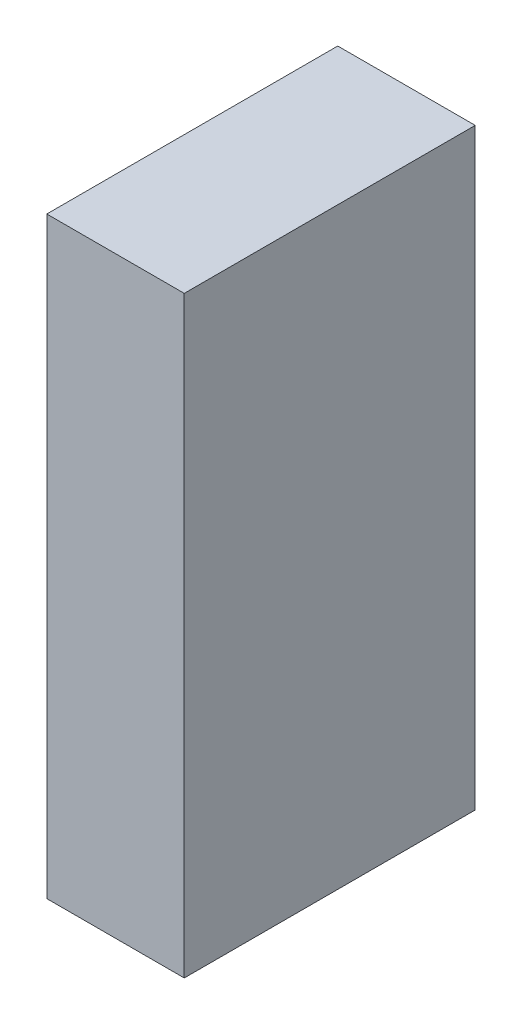
from build123d import *

# Parameters (mm, degrees)
SKETCH1_W                                    = 184.15
SKETCH1_H                                    = 184.15
PANEL_DEPTH                                  = 2.75
LED_HOLE_REACH                               = 132.243
SKETCH19_R                                   = 2.75
LED_HOLES_PATTERN_COUNT                      = 13
LED_HOLES_PATTERN_PITCH                      = 12.319
LED_HOLES_PATTERN_COUNT_DIR2                 = 10
LED_HOLES_PATTERN_PITCH_DIR2                 = 15.94
SKETCH2_R                                    = 2.75
SKETCH2_W                                    = 4.99243385
SKETCH2_H                                    = 2.307727076
CORNER_LEDS_LIGHT_SENSOR_CUT_DEPTH           = 131.242749318
LIGHT_SENSOR_HOLDER_DEPTH                    = 2.4
SKETCH6_W                                    = 164.47360298
SKETCH6_H                                    = 161.542860252
OUTER_LIGHT_WALLS_DEPTH                      = 6.35
SKETCH7_W                                    = 158.47360298
SKETCH7_H                                    = 155.542860252
OUTER_LIGHT_WALLS_CUT_DEPTH                  = 7.5
SKETCH8_W                                    = 158.47560298
SKETCH8_H                                    = 3
INNER_H_WALLS_DEPTH                          = 7.5
INNER_H_WALLS_PATTERN_COUNT                  = 9
INNER_H_WALLS_PATTERN_PITCH                  = 15.94
INNER_START                                  = -1.15
INNER_V_WALLS_1ST_LINE_DEPTH                 = 7.5
INNER_V_WALLS_PATTERN_1ST_LINE_COUNT         = 12
INNER_V_WALLS_PATTERN_1ST_LINE_PITCH         = 12.32
SKETCH13_W                                   = 3
SKETCH13_H                                   = 12.501430126
EXTRA_V_WALLS_REMOVAL_1ST_LINE_DEPTH         = 7.5
SKETCH14_W                                   = 3
SKETCH14_H                                   = 12.94
INNER_V_WALLS_DEPTH                          = 6.35
INNER_V_WALLS_PATTERN_COUNT                  = 12
INNER_V_WALLS_PATTERN_PITCH                  = 12.32
INNER_V_WALLS_PATTERN_COUNT_DIR2             = 9
INNER_V_WALLS_PATTERN_PITCH_DIR2             = 15.94
SKETCH15_W                                   = 3
SKETCH15_H                                   = 12.94
EXTRA_V_WALLS_REMOVAL_DEPTH                  = 7.5
SKETCH16_W                                   = 6.43819851
SKETCH16_H                                   = 3
SKETCH16_W_2                                 = 3
SKETCH16_H_2                                 = 7.903569874
CORNER_LED_LIGHT_BAFFLES_DEPTH               = 6.35
CORNER_LED_LIGHT_BAFFLES_MIRROR_2_COPY_1_W   = 6.43819851
CORNER_LED_LIGHT_BAFFLES_MIRROR_2_COPY_1_H   = 3
CORNER_LED_LIGHT_BAFFLES_MIRROR_2_COPY_1_W_2 = 3
CORNER_LED_LIGHT_BAFFLES_MIRROR_2_COPY_1_H_2 = 7.903569874
CORNER_LED_LIGHT_BAFFLES_MIRROR_2_CO_2_DEPTH = 6.35
LED_STRIP_SQUARE_HOLE_1ST_LINE_REACH         = 132.43
SKETCH20_W                                   = 5.5
SKETCH20_H                                   = 5.5
LED_STRIP_SQUARE_HOLE_REACH                  = 132.43
SKETCH22_W                                   = 5.5
SKETCH22_H                                   = 5.5
LED_STRIP_SQUARE_HOLES_PATTERN_COUNT         = 13
LED_STRIP_SQUARE_HOLES_PATTERN_PITCH         = 12.319
LED_STRIP_SQUARE_HOLES_PATTERN_COUNT_DIR2    = 6
LED_STRIP_SQUARE_HOLES_PATTERN_PITCH_DIR2    = 15.94
SKETCH27_W                                   = 149.47360298
SKETCH27_H                                   = 7.903569874
SKETCH27_W_2                                 = 6.43819851
SKETCH27_H_2                                 = 146.542860252
CUT_EXTRUDE15_DEPTH                          = 1
CHAMFER1_SIZE                                = 1
SKETCH30_OUTSIDE_W                           = 238.268
SKETCH30_OUTSIDE_H                           = 238.268
SKETCH30_OUTSIDE_W_2                         = 3
SKETCH30_OUTSIDE_H_2                         = 12.94
CUT_EXTRUDE24_DEPTH                          = 7.5


with BuildPart() as part:
    # Sketch1 → panel (new body)
    with BuildSketch(Plane.XY):
        Rectangle(SKETCH1_W, SKETCH1_H)
    extrude(amount=PANEL_DEPTH)

    # Sketch19 → LED hole (cut, up to next)
    with BuildSketch(Plane.XY.offset(2.75), mode=Mode.PRIVATE) as led_hole_sk1:
        with Locations((-73.915, 71.74)):
            Circle(SKETCH19_R)
    led_hole_tool1 = extrude(led_hole_sk1.sketch, amount=-LED_HOLE_REACH, mode=Mode.PRIVATE) & part.part
    led_hole = led_hole_tool1.solids().sort_by_distance((-73.915, 71.74, 2.75))[0]
    add(led_hole, mode=Mode.SUBTRACT)

    # LED holes pattern: LED hole 13 × 10, 32 skipped
    with Locations(*[(i * LED_HOLES_PATTERN_PITCH, -j * LED_HOLES_PATTERN_PITCH_DIR2, 0) for i in range(LED_HOLES_PATTERN_COUNT) for j in range(LED_HOLES_PATTERN_COUNT_DIR2) if (i, j) not in ((0, 0), (0, 3), (0, 4), (1, 3), (1, 4), (2, 0), (2, 3), (2, 4), (3, 3), (3, 4), (3, 6), (3, 8), (4, 2), (4, 3), (4, 4), (4, 6), (4, 8), (5, 0), (5, 3), (5, 4), (5, 6), (5, 8), (6, 3), (6, 4), (6, 6), (6, 8), (6, 9), (7, 4), (7, 8), (8, 8), (9, 8), (12, 2), (12, 6))]):
        add(led_hole, mode=Mode.SUBTRACT)

    # Sketch2 → corner LEDs _ light sensor cut (cut, through all)
    with BuildSketch(Plane.XY.offset(2.75)):
        with Locations((-84.075, 84.075)):
            Circle(SKETCH2_R)
        with Locations(Location((84.075, 84.075, 0), (0, 0, 180))):
            Circle(SKETCH2_R)
        with Locations((84.075, -84.075)):
            Circle(SKETCH2_R)
        with Locations(Location((-84.075, -84.075, 0), (0, 0, 180))):
            Circle(SKETCH2_R)
        with Locations((0, 84.075)):
            Rectangle(SKETCH2_W, SKETCH2_H)
    extrude(amount=-CORNER_LEDS_LIGHT_SENSOR_CUT_DEPTH, mode=Mode.SUBTRACT)

    # Sketch3 → light sensor holder (cut)
    with BuildSketch(Plane.XY.offset(2.75)):
        with BuildLine():
            Line((-1.58113883, 81.825), (1.58113883, 81.825))
            ThreePointArc((1.58113883, 81.825), (2.75, 84.075), (1.58113883, 86.325))
            Line((1.58113883, 86.325), (-1.58113883, 86.325))
            ThreePointArc((-1.58113883, 86.325), (-2.75, 84.075), (-1.58113883, 81.825))
        make_face()
    extrude(amount=-LIGHT_SENSOR_HOLDER_DEPTH, mode=Mode.SUBTRACT)

    # Sketch6 → outer light walls (add)
    with BuildSketch(Plane.XY.offset(2.75)):
        Rectangle(SKETCH6_W, SKETCH6_H)
    extrude(amount=OUTER_LIGHT_WALLS_DEPTH)

    # Sketch7 → outer light walls cut (cut)
    with BuildSketch(Plane.XY.offset(9.1)):
        Rectangle(SKETCH7_W, SKETCH7_H)
    extrude(amount=-OUTER_LIGHT_WALLS_CUT_DEPTH, mode=Mode.SUBTRACT)

    # Sketch8 → inner H walls (add)
    with BuildSketch(Plane.XY.offset(1.6)):
        with Locations((-0.001, 63.77)):
            Rectangle(SKETCH8_W, SKETCH8_H)
    inner_h_walls = extrude(amount=INNER_H_WALLS_DEPTH)

    # inner H walls pattern: inner H walls ×9
    with Locations(*[(0, -i * INNER_H_WALLS_PATTERN_PITCH, 0) for i in range(1, INNER_H_WALLS_PATTERN_COUNT)]):
        add(inner_h_walls)

    # Sketch12 → inner V walls _1st line (add)
    with BuildSketch(Plane.XY.offset(2.75).offset(INNER_START)):
        Polygon((-69.2555, 65.708569874), (-69.2555, 65.27), (-66.2555, 65.27), (-66.2555, 65.708569874), (-66.2555, 77.771430126), (-69.2555, 77.771430126), align=None)
    inner_v_walls_1st_line = extrude(amount=INNER_V_WALLS_1ST_LINE_DEPTH)

    # inner V walls pattern _1st line: inner V walls _1st line ×12, 6 skipped
    with Locations(*[(i * INNER_V_WALLS_PATTERN_1ST_LINE_PITCH, 0, 0) for i in range(1, INNER_V_WALLS_PATTERN_1ST_LINE_COUNT) if i not in (3, 6, 7, 9, 10, 11)]):
        add(inner_v_walls_1st_line)

    # Sketch13 → extra V walls removal _1st line (cut)
    with BuildSketch(Plane.XY.offset(9.1)):
        with Locations((-67.7555, 71.520715063)):
            Rectangle(SKETCH13_W, SKETCH13_H)
    extrude(amount=-EXTRA_V_WALLS_REMOVAL_1ST_LINE_DEPTH, mode=Mode.SUBTRACT)

    # Sketch14 → inner V walls (add)
    with BuildSketch(Plane.XY.offset(2.75)):
        with Locations((-67.7555, 55.8)):
            Rectangle(SKETCH14_W, SKETCH14_H)
    inner_v_walls = extrude(amount=INNER_V_WALLS_DEPTH)

    # inner V walls pattern: inner V walls 12 × 9, 86 skipped
    with Locations(*[(i * INNER_V_WALLS_PATTERN_PITCH, -j * INNER_V_WALLS_PATTERN_PITCH_DIR2, 0) for i in range(INNER_V_WALLS_PATTERN_COUNT) for j in range(INNER_V_WALLS_PATTERN_COUNT_DIR2) if (i, j) not in ((0, 0), (0, 1), (0, 2), (0, 3), (0, 4), (0, 5), (0, 6), (0, 7), (0, 8), (1, 0), (1, 1), (1, 2), (1, 3), (1, 4), (1, 5), (1, 6), (1, 7), (1, 8), (2, 0), (2, 1), (2, 2), (2, 3), (2, 4), (2, 6), (2, 8), (3, 0), (3, 2), (3, 3), (3, 4), (3, 5), (3, 7), (3, 8), (4, 0), (4, 4), (4, 5), (4, 6), (4, 7), (4, 8), (5, 0), (5, 1), (5, 2), (5, 3), (5, 5), (5, 6), (5, 7), (6, 1), (6, 3), (6, 4), (6, 6), (6, 7), (7, 0), (7, 1), (7, 2), (7, 4), (7, 5), (7, 6), (7, 7), (8, 0), (8, 1), (8, 2), (8, 3), (8, 4), (8, 5), (8, 7), (8, 8), (9, 0), (9, 1), (9, 2), (9, 3), (9, 5), (9, 6), (9, 8), (10, 0), (10, 1), (10, 3), (10, 4), (10, 5), (10, 6), (10, 7), (10, 8), (11, 0), (11, 2), (11, 3), (11, 4), (11, 6), (11, 7), (11, 8))]):
        add(inner_v_walls)

    # Sketch15 → extra V walls removal (cut)
    with BuildSketch(Plane.XY.offset(9.1)):
        with Locations((-67.7555, 55.8)):
            Rectangle(SKETCH15_W, SKETCH15_H)
    extrude(amount=-EXTRA_V_WALLS_REMOVAL_DEPTH, mode=Mode.SUBTRACT)

    # Sketch16 → corner LED light baffles (add)
    with BuildSketch(Plane.XY.offset(2.75)):
        with Locations((-85.455900745, 74.771430126)):
            Rectangle(SKETCH16_W, SKETCH16_H)
        with Locations((-76.23680149, 84.723215063)):
            Rectangle(SKETCH16_W_2, SKETCH16_H_2)
    corner_led_light_baffles = extrude(amount=CORNER_LED_LIGHT_BAFFLES_DEPTH)

    # corner LED light baffles mirror: corner LED light baffles across plane
    add(corner_led_light_baffles.mirror(Plane(origin=(0, 0, 0), x_dir=(0, 0, 1), z_dir=(1, 0, 0))))

    # corner LED light baffles mirror 2: corner LED light baffles across plane
    add(corner_led_light_baffles.mirror(Plane.ZX))

    # corner LED light baffles mirror 2 copy 1 → corner LED light baffles mirror 2 co 2 (add)
    with BuildSketch(Plane(origin=(0, 0, 2.75), x_dir=(-1, 0, 0), z_dir=(0, 0, 1))):
        with Locations((-85.455900745, 74.771430126)):
            Rectangle(CORNER_LED_LIGHT_BAFFLES_MIRROR_2_COPY_1_W, CORNER_LED_LIGHT_BAFFLES_MIRROR_2_COPY_1_H)
        with Locations((-76.23680149, 84.723215063)):
            Rectangle(CORNER_LED_LIGHT_BAFFLES_MIRROR_2_COPY_1_W_2, CORNER_LED_LIGHT_BAFFLES_MIRROR_2_COPY_1_H_2)
    extrude(amount=CORNER_LED_LIGHT_BAFFLES_MIRROR_2_CO_2_DEPTH)

    # Sketch20 → LED strip square hole _1st line (cut, up to next)
    with BuildSketch(Plane.XY.offset(1.6), mode=Mode.PRIVATE) as led_strip_square_hole_1st_line_sk1:
        with Locations((-49.2755, 71.520715063)):
            Rectangle(SKETCH20_W, SKETCH20_H)
    led_strip_square_hole_1st_line_tool1 = extrude(led_strip_square_hole_1st_line_sk1.sketch, amount=-LED_STRIP_SQUARE_HOLE_1ST_LINE_REACH, mode=Mode.PRIVATE) & part.part
    add(led_strip_square_hole_1st_line_tool1.solids().sort_by_distance((-49.2755, 71.520715, 1.6))[0], mode=Mode.SUBTRACT)

    # Sketch22 → LED strip square hole (cut, up to next)
    with BuildSketch(Plane.XY.offset(1.6), mode=Mode.PRIVATE) as led_strip_square_hole_sk1:
        with Locations((-73.915, 23.92)):
            Rectangle(SKETCH22_W, SKETCH22_H)
    led_strip_square_hole_tool1 = extrude(led_strip_square_hole_sk1.sketch, amount=-LED_STRIP_SQUARE_HOLE_REACH, mode=Mode.PRIVATE) & part.part
    led_strip_square_hole = led_strip_square_hole_tool1.solids().sort_by_distance((-73.915, 23.92, 1.6))[0]
    add(led_strip_square_hole, mode=Mode.SUBTRACT)

    # LED strip square holes pattern: LED strip square hole 13 × 6, 51 skipped
    with Locations(*[(i * LED_STRIP_SQUARE_HOLES_PATTERN_PITCH, -j * LED_STRIP_SQUARE_HOLES_PATTERN_PITCH_DIR2, 0) for i in range(LED_STRIP_SQUARE_HOLES_PATTERN_COUNT) for j in range(LED_STRIP_SQUARE_HOLES_PATTERN_COUNT_DIR2) if (i, j) not in ((0, 0), (0, 2), (0, 3), (0, 4), (0, 5), (1, 2), (1, 3), (1, 4), (1, 5), (2, 2), (2, 3), (2, 4), (2, 5), (3, 2), (3, 4), (4, 2), (4, 4), (5, 2), (5, 4), (6, 2), (6, 4), (7, 0), (7, 2), (7, 3), (7, 4), (8, 0), (8, 1), (8, 2), (8, 3), (8, 4), (9, 0), (9, 1), (9, 2), (9, 3), (9, 4), (10, 0), (10, 1), (10, 2), (10, 3), (10, 4), (10, 5), (11, 0), (11, 1), (11, 2), (11, 3), (11, 4), (11, 5), (12, 0), (12, 1), (12, 2), (12, 4), (12, 5))]):
        add(led_strip_square_hole, mode=Mode.SUBTRACT)

    # Sketch27 → Cut-Extrude15 (cut)
    with BuildSketch(Plane.XY.offset(2.75)):
        with Locations((0, 84.723215063)):
            Rectangle(SKETCH27_W, SKETCH27_H)
        with Locations((-85.455900745, 0)):
            Rectangle(SKETCH27_W_2, SKETCH27_H_2)
        with Locations((0, -84.723215063)):
            Rectangle(SKETCH27_W, SKETCH27_H)
        with Locations((85.455900745, 0)):
            Rectangle(SKETCH27_W_2, SKETCH27_H_2)
    extrude(amount=-CUT_EXTRUDE15_DEPTH, mode=Mode.SUBTRACT)

    # Chamfer1
    chamfer1_edges = [part.edges().sort_by_distance(p)[0] for p in [
        (-92.075, 0, 2.75),
        (0, -92.075, 2.75),
        (92.075, 0, 2.75),
        (0, 92.075, 2.75),
    ]]
    chamfer(chamfer1_edges, length=CHAMFER1_SIZE)

    # Sketch30 outside → Cut-Extrude24 (cut)
    with BuildSketch(Plane.XY.offset(9.1)):
        Rectangle(SKETCH30_OUTSIDE_W, SKETCH30_OUTSIDE_H)
        with Locations((-18.4755, 7.98)):
            Rectangle(SKETCH30_OUTSIDE_W_2, SKETCH30_OUTSIDE_H_2, mode=Mode.SUBTRACT)
    extrude(amount=-CUT_EXTRUDE24_DEPTH, mode=Mode.SUBTRACT)


with BuildPart() as cut_extrude24_kept_piece:
    # of the separate pieces the step leaves, the one the design keeps (cut_extrude24_pieces_kept)
    add(part.part.solids().sort_by_distance((-19.9755, 14.45, 2.75))[0])


solid = cut_extrude24_kept_piece.part
